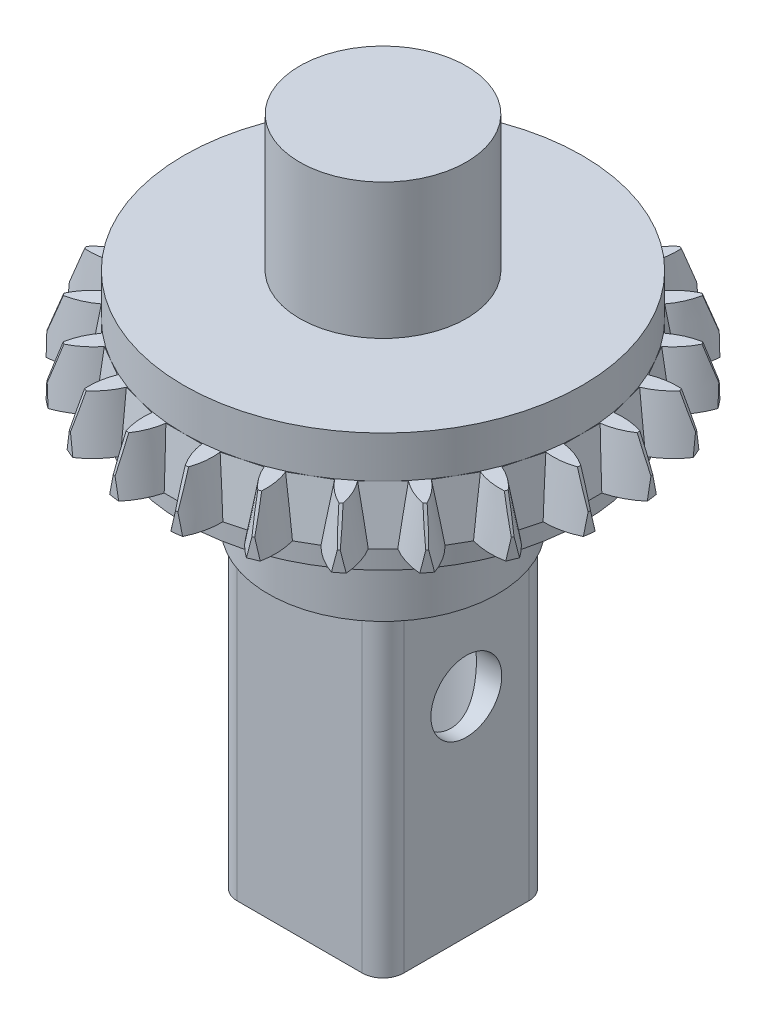
from build123d import *

# Parameters (mm, degrees)
SKETCH1_R                 = 11.5
BOSS_EXTRUDE1_DEPTH       = 2.5
CUT_EXTRUDE2_DEPTH        = 2.5
CUT_EXTRUDE2_DRAFT        = 10
CIRPATTERN1_COPY_1_DEPTH  = 2.5
CIRPATTERN1_COPY_1_DRAFT  = 10
CIRPATTERN1_COPY_2_DEPTH  = 2.5
CIRPATTERN1_COPY_2_DRAFT  = 10
CIRPATTERN1_COPY_3_DEPTH  = 2.5
CIRPATTERN1_COPY_3_DRAFT  = 10
CIRPATTERN1_COPY_4_DEPTH  = 2.5
CIRPATTERN1_COPY_4_DRAFT  = 10
CIRPATTERN1_COPY_5_DEPTH  = 2.5
CIRPATTERN1_COPY_5_DRAFT  = 10
CIRPATTERN1_COPY_6_DEPTH  = 2.5
CIRPATTERN1_COPY_6_DRAFT  = 10
CIRPATTERN1_COPY_7_DEPTH  = 2.5
CIRPATTERN1_COPY_7_DRAFT  = 10
CIRPATTERN1_COPY_8_DEPTH  = 2.5
CIRPATTERN1_COPY_8_DRAFT  = 10
CIRPATTERN1_COPY_9_DEPTH  = 2.5
CIRPATTERN1_COPY_9_DRAFT  = 10
CIRPATTERN1_COPY_10_DEPTH = 2.5
CIRPATTERN1_COPY_10_DRAFT = 10
CIRPATTERN1_COPY_11_DEPTH = 2.5
CIRPATTERN1_COPY_11_DRAFT = 10
CIRPATTERN1_COPY_12_DEPTH = 2.5
CIRPATTERN1_COPY_12_DRAFT = 10
CIRPATTERN1_COPY_13_DEPTH = 2.5
CIRPATTERN1_COPY_13_DRAFT = 10
CIRPATTERN1_COPY_14_DEPTH = 2.5
CIRPATTERN1_COPY_14_DRAFT = 10
CIRPATTERN1_COPY_15_DEPTH = 2.5
CIRPATTERN1_COPY_15_DRAFT = 10
CIRPATTERN1_COPY_16_DEPTH = 2.5
CIRPATTERN1_COPY_16_DRAFT = 10
CIRPATTERN1_COPY_17_DEPTH = 2.5
CIRPATTERN1_COPY_17_DRAFT = 10
CIRPATTERN1_COPY_18_DEPTH = 2.5
CIRPATTERN1_COPY_18_DRAFT = 10
CIRPATTERN1_COPY_19_DEPTH = 2.5
CIRPATTERN1_COPY_19_DRAFT = 10
CIRPATTERN1_COPY_20_DEPTH = 2.5
CIRPATTERN1_COPY_20_DRAFT = 10
CIRPATTERN1_COPY_21_DEPTH = 2.5
CIRPATTERN1_COPY_21_DRAFT = 10
CIRPATTERN1_COPY_22_DEPTH = 2.5
CIRPATTERN1_COPY_22_DRAFT = 10
CIRPATTERN1_COPY_23_DEPTH = 2.5
CIRPATTERN1_COPY_23_DRAFT = 10
SKETCH5_R                 = 4
BOSS_EXTRUDE2_DEPTH       = 8.5
SKETCH7_R                 = 9.559182548
BOSS_EXTRUDE4_DEPTH       = 1.2
BOSS_EXTRUDE5_START       = 2
SKETCH10_R                = 9.559182548
BOSS_EXTRUDE5_DEPTH       = 2
SKETCH11_R                = 5.5
BOSS_EXTRUDE6_DEPTH       = 5
SKETCH6_W                 = 8
SKETCH6_H                 = 8
SKETCH6_R                 = 3.26
BOSS_EXTRUDE3_DEPTH       = 15
SKETCH8_R                 = 1.7
CUT_EXTRUDE3_DEPTH        = 29.605417534
FILLET1_R                 = 1


with BuildPart() as part:
    # Sketch1 → Boss-Extrude1 (new body)
    with BuildSketch(Plane(origin=(0, 0, 0), x_dir=(1, 0, 0), z_dir=(0, 1, 0))):
        with Locations(Location((0, 0, 0), (0, 0, 270))):
            Circle(SKETCH1_R)
    extrude(amount=BOSS_EXTRUDE1_DEPTH)


with BuildPart() as cut_extrude2_tool:
    # Sketch4 → Cut-Extrude2 (with draft: the straight prism first)
    with BuildSketch(Plane.XZ):
        with BuildLine():
            Line((-0.5, 10), (0.5, 10))
            ThreePointArc((0.5, 10), (0.791208568, 10.759821048), (1.25, 11.431863365))
            ThreePointArc((1.25, 11.431863365), (0, 11.5), (-1.25, 11.431863365))
            ThreePointArc((-1.25, 11.431863365), (-0.791208568, 10.759821048), (-0.5, 10))
        make_face()
    extrude(amount=-CUT_EXTRUDE2_DEPTH)
    # Cut-Extrude2: the draft: its side faces are tilted about the plane it starts from
    cut_extrude2_sides = [cut_extrude2_tool.faces().sort_by_distance(p)[0] for p in [
        (-0.791208568, 1.25, 10.759821048),
        (0, 1.25, 10),
        (0.791208568, 1.25, 10.759821048),
        (0, 1.25, 11.5),
    ]]
    draft(cut_extrude2_sides, Plane.XZ, CUT_EXTRUDE2_DRAFT)


with BuildPart() as part_1:
    add(part.part)

    # Cut-Extrude2: cut by cut_extrude2_tool
    add(cut_extrude2_tool.part, mode=Mode.SUBTRACT)


with BuildPart() as cirpattern1_copy_1_tool:
    # CirPattern1 copy 1 sketch → CirPattern1 copy 1 (with draft: the straight prism first)
    with BuildSketch(Plane(origin=(0, 0, 0), x_dir=(0.9659258262890683, 0, -0.25881904510252074), z_dir=(0, -1, 0))):
        with BuildLine():
            Line((-0.5, 10), (0.5, 10))
            ThreePointArc((0.5, 10), (0.791208568, 10.759821048), (1.25, 11.431863365))
            ThreePointArc((1.25, 11.431863365), (0, 11.5), (-1.25, 11.431863365))
            ThreePointArc((-1.25, 11.431863365), (-0.791208568, 10.759821048), (-0.5, 10))
        make_face()
    extrude(amount=-CIRPATTERN1_COPY_1_DEPTH)
    # CirPattern1 copy 1: the draft: its side faces are tilted about the plane it starts from
    cirpattern1_copy_1_sides = [cirpattern1_copy_1_tool.faces().sort_by_distance(p)[0] for p in [
        (2.020597819, 1.25, 10.597968883),
        (2.588190451, 1.25, 9.659258263),
        (3.549095399, 1.25, 10.18840919),
        (2.976419019, 1.25, 11.108147002),
    ]]
    draft(cirpattern1_copy_1_sides, Plane(origin=(0, 0, 0), x_dir=(0.9659258262890683, 0, -0.25881904510252074), z_dir=(0, -1, 0)), CIRPATTERN1_COPY_1_DRAFT)


with BuildPart() as part_2:
    add(part_1.part)

    # CirPattern1 copy 1: cut by cirpattern1_copy_1_tool
    add(cirpattern1_copy_1_tool.part, mode=Mode.SUBTRACT)


with BuildPart() as cirpattern1_copy_2_tool:
    # CirPattern1 copy 2 sketch → CirPattern1 copy 2 (with draft: the straight prism first)
    with BuildSketch(Plane(origin=(0, 0, 0), x_dir=(0.8660254037844387, 0, -0.49999999999999994), z_dir=(0, -1, 0))):
        with BuildLine():
            Line((-0.5, 10), (0.5, 10))
            ThreePointArc((0.5, 10), (0.791208568, 10.759821048), (1.25, 11.431863365))
            ThreePointArc((1.25, 11.431863365), (0, 11.5), (-1.25, 11.431863365))
            ThreePointArc((-1.25, 11.431863365), (-0.791208568, 10.759821048), (-0.5, 10))
        make_face()
    extrude(amount=-CIRPATTERN1_COPY_2_DEPTH)
    # CirPattern1 copy 2: the draft: its side faces are tilted about the plane it starts from
    cirpattern1_copy_2_sides = [cirpattern1_copy_2_tool.faces().sort_by_distance(p)[0] for p in [
        (4.694703804, 1.25, 9.713882652),
        (5, 1.25, 8.660254038),
        (6.065117244, 1.25, 8.922674084),
        (5.75, 1.25, 9.959292144),
    ]]
    draft(cirpattern1_copy_2_sides, Plane(origin=(0, 0, 0), x_dir=(0.8660254037844387, 0, -0.49999999999999994), z_dir=(0, -1, 0)), CIRPATTERN1_COPY_2_DRAFT)


with BuildPart() as part_3:
    add(part_2.part)

    # CirPattern1 copy 2: cut by cirpattern1_copy_2_tool
    add(cirpattern1_copy_2_tool.part, mode=Mode.SUBTRACT)


with BuildPart() as cirpattern1_copy_3_tool:
    # CirPattern1 copy 3 sketch → CirPattern1 copy 3 (with draft: the straight prism first)
    with BuildSketch(Plane(origin=(0, 0, 0), x_dir=(0.7071067811865476, 0, -0.7071067811865475), z_dir=(0, -1, 0))):
        with BuildLine():
            Line((-0.5, 10), (0.5, 10))
            ThreePointArc((0.5, 10), (0.791208568, 10.759821048), (1.25, 11.431863365))
            ThreePointArc((1.25, 11.431863365), (0, 11.5), (-1.25, 11.431863365))
            ThreePointArc((-1.25, 11.431863365), (-0.791208568, 10.759821048), (-0.5, 10))
        make_face()
    extrude(amount=-CIRPATTERN1_COPY_3_DEPTH)
    # CirPattern1 copy 3: the draft: its side faces are tilted about the plane it starts from
    cirpattern1_copy_3_sides = [cirpattern1_copy_3_tool.faces().sort_by_distance(p)[0] for p in [
        (7.048873484, 1.25, 8.167811371),
        (7.071067812, 1.25, 7.071067812),
        (8.167811371, 1.25, 7.048873484),
        (8.131727984, 1.25, 8.131727984),
    ]]
    draft(cirpattern1_copy_3_sides, Plane(origin=(0, 0, 0), x_dir=(0.7071067811865476, 0, -0.7071067811865475), z_dir=(0, -1, 0)), CIRPATTERN1_COPY_3_DRAFT)


with BuildPart() as part_4:
    add(part_3.part)

    # CirPattern1 copy 3: cut by cirpattern1_copy_3_tool
    add(cirpattern1_copy_3_tool.part, mode=Mode.SUBTRACT)


with BuildPart() as cirpattern1_copy_4_tool:
    # CirPattern1 copy 4 sketch → CirPattern1 copy 4 (with draft: the straight prism first)
    with BuildSketch(Plane(origin=(0, 0, 0), x_dir=(0.5000000000000001, 0, -0.8660254037844386), z_dir=(0, -1, 0))):
        with BuildLine():
            Line((-0.5, 10), (0.5, 10))
            ThreePointArc((0.5, 10), (0.791208568, 10.759821048), (1.25, 11.431863365))
            ThreePointArc((1.25, 11.431863365), (0, 11.5), (-1.25, 11.431863365))
            ThreePointArc((-1.25, 11.431863365), (-0.791208568, 10.759821048), (-0.5, 10))
        make_face()
    extrude(amount=-CIRPATTERN1_COPY_4_DEPTH)
    # CirPattern1 copy 4: the draft: its side faces are tilted about the plane it starts from
    cirpattern1_copy_4_sides = [cirpattern1_copy_4_tool.faces().sort_by_distance(p)[0] for p in [
        (8.922674084, 1.25, 6.065117244),
        (8.660254038, 1.25, 5),
        (9.713882652, 1.25, 4.694703804),
        (9.959292144, 1.25, 5.75),
    ]]
    draft(cirpattern1_copy_4_sides, Plane(origin=(0, 0, 0), x_dir=(0.5000000000000001, 0, -0.8660254037844386), z_dir=(0, -1, 0)), CIRPATTERN1_COPY_4_DRAFT)


with BuildPart() as part_5:
    add(part_4.part)

    # CirPattern1 copy 4: cut by cirpattern1_copy_4_tool
    add(cirpattern1_copy_4_tool.part, mode=Mode.SUBTRACT)


with BuildPart() as cirpattern1_copy_5_tool:
    # CirPattern1 copy 5 sketch → CirPattern1 copy 5 (with draft: the straight prism first)
    with BuildSketch(Plane(origin=(0, 0, 0), x_dir=(0.25881904510252074, 0, -0.9659258262890683), z_dir=(0, -1, 0))):
        with BuildLine():
            Line((-0.5, 10), (0.5, 10))
            ThreePointArc((0.5, 10), (0.791208568, 10.759821048), (1.25, 11.431863365))
            ThreePointArc((1.25, 11.431863365), (0, 11.5), (-1.25, 11.431863365))
            ThreePointArc((-1.25, 11.431863365), (-0.791208568, 10.759821048), (-0.5, 10))
        make_face()
    extrude(amount=-CIRPATTERN1_COPY_5_DEPTH)
    # CirPattern1 copy 5: the draft: its side faces are tilted about the plane it starts from
    cirpattern1_copy_5_sides = [cirpattern1_copy_5_tool.faces().sort_by_distance(p)[0] for p in [
        (10.18840919, 1.25, 3.549095399),
        (9.659258263, 1.25, 2.588190451),
        (10.597968883, 1.25, 2.020597819),
        (11.108147002, 1.25, 2.976419019),
    ]]
    draft(cirpattern1_copy_5_sides, Plane(origin=(0, 0, 0), x_dir=(0.25881904510252074, 0, -0.9659258262890683), z_dir=(0, -1, 0)), CIRPATTERN1_COPY_5_DRAFT)


with BuildPart() as part_6:
    add(part_5.part)

    # CirPattern1 copy 5: cut by cirpattern1_copy_5_tool
    add(cirpattern1_copy_5_tool.part, mode=Mode.SUBTRACT)


with BuildPart() as cirpattern1_copy_6_tool:
    # CirPattern1 copy 6 sketch → CirPattern1 copy 6 (with draft: the straight prism first)
    with BuildSketch(Plane(origin=(0, 0, 0), x_dir=(0, 0, -1), z_dir=(0, -1, 0))):
        with BuildLine():
            Line((-0.5, 10), (0.5, 10))
            ThreePointArc((0.5, 10), (0.791208568, 10.759821048), (1.25, 11.431863365))
            ThreePointArc((1.25, 11.431863365), (0, 11.5), (-1.25, 11.431863365))
            ThreePointArc((-1.25, 11.431863365), (-0.791208568, 10.759821048), (-0.5, 10))
        make_face()
    extrude(amount=-CIRPATTERN1_COPY_6_DEPTH)
    # CirPattern1 copy 6: the draft: its side faces are tilted about the plane it starts from
    cirpattern1_copy_6_sides = [cirpattern1_copy_6_tool.faces().sort_by_distance(p)[0] for p in [
        (10.759821048, 1.25, 0.791208568),
        (10, 1.25, 0),
        (10.759821048, 1.25, -0.791208568),
        (11.5, 1.25, 0),
    ]]
    draft(cirpattern1_copy_6_sides, Plane(origin=(0, 0, 0), x_dir=(0, 0, -1), z_dir=(0, -1, 0)), CIRPATTERN1_COPY_6_DRAFT)


with BuildPart() as part_7:
    add(part_6.part)

    # CirPattern1 copy 6: cut by cirpattern1_copy_6_tool
    add(cirpattern1_copy_6_tool.part, mode=Mode.SUBTRACT)


with BuildPart() as cirpattern1_copy_7_tool:
    # CirPattern1 copy 7 sketch → CirPattern1 copy 7 (with draft: the straight prism first)
    with BuildSketch(Plane(origin=(0, 0, 0), x_dir=(-0.25881904510252085, 0, -0.9659258262890683), z_dir=(0, -1, 0))):
        with BuildLine():
            Line((-0.5, 10), (0.5, 10))
            ThreePointArc((0.5, 10), (0.791208568, 10.759821048), (1.25, 11.431863365))
            ThreePointArc((1.25, 11.431863365), (0, 11.5), (-1.25, 11.431863365))
            ThreePointArc((-1.25, 11.431863365), (-0.791208568, 10.759821048), (-0.5, 10))
        make_face()
    extrude(amount=-CIRPATTERN1_COPY_7_DEPTH)
    # CirPattern1 copy 7: the draft: its side faces are tilted about the plane it starts from
    cirpattern1_copy_7_sides = [cirpattern1_copy_7_tool.faces().sort_by_distance(p)[0] for p in [
        (10.597968883, 1.25, -2.020597819),
        (9.659258263, 1.25, -2.588190451),
        (10.18840919, 1.25, -3.549095399),
        (11.108147002, 1.25, -2.976419019),
    ]]
    draft(cirpattern1_copy_7_sides, Plane(origin=(0, 0, 0), x_dir=(-0.25881904510252085, 0, -0.9659258262890683), z_dir=(0, -1, 0)), CIRPATTERN1_COPY_7_DRAFT)


with BuildPart() as part_8:
    add(part_7.part)

    # CirPattern1 copy 7: cut by cirpattern1_copy_7_tool
    add(cirpattern1_copy_7_tool.part, mode=Mode.SUBTRACT)


with BuildPart() as cirpattern1_copy_8_tool:
    # CirPattern1 copy 8 sketch → CirPattern1 copy 8 (with draft: the straight prism first)
    with BuildSketch(Plane(origin=(0, 0, 0), x_dir=(-0.4999999999999998, 0, -0.8660254037844387), z_dir=(0, -1, 0))):
        with BuildLine():
            Line((-0.5, 10), (0.5, 10))
            ThreePointArc((0.5, 10), (0.791208568, 10.759821048), (1.25, 11.431863365))
            ThreePointArc((1.25, 11.431863365), (0, 11.5), (-1.25, 11.431863365))
            ThreePointArc((-1.25, 11.431863365), (-0.791208568, 10.759821048), (-0.5, 10))
        make_face()
    extrude(amount=-CIRPATTERN1_COPY_8_DEPTH)
    # CirPattern1 copy 8: the draft: its side faces are tilted about the plane it starts from
    cirpattern1_copy_8_sides = [cirpattern1_copy_8_tool.faces().sort_by_distance(p)[0] for p in [
        (9.713882652, 1.25, -4.694703804),
        (8.660254038, 1.25, -5),
        (8.922674084, 1.25, -6.065117244),
        (9.959292144, 1.25, -5.75),
    ]]
    draft(cirpattern1_copy_8_sides, Plane(origin=(0, 0, 0), x_dir=(-0.4999999999999998, 0, -0.8660254037844387), z_dir=(0, -1, 0)), CIRPATTERN1_COPY_8_DRAFT)


with BuildPart() as part_9:
    add(part_8.part)

    # CirPattern1 copy 8: cut by cirpattern1_copy_8_tool
    add(cirpattern1_copy_8_tool.part, mode=Mode.SUBTRACT)


with BuildPart() as cirpattern1_copy_9_tool:
    # CirPattern1 copy 9 sketch → CirPattern1 copy 9 (with draft: the straight prism first)
    with BuildSketch(Plane(origin=(0, 0, 0), x_dir=(-0.7071067811865475, 0, -0.7071067811865476), z_dir=(0, -1, 0))):
        with BuildLine():
            Line((-0.5, 10), (0.5, 10))
            ThreePointArc((0.5, 10), (0.791208568, 10.759821048), (1.25, 11.431863365))
            ThreePointArc((1.25, 11.431863365), (0, 11.5), (-1.25, 11.431863365))
            ThreePointArc((-1.25, 11.431863365), (-0.791208568, 10.759821048), (-0.5, 10))
        make_face()
    extrude(amount=-CIRPATTERN1_COPY_9_DEPTH)
    # CirPattern1 copy 9: the draft: its side faces are tilted about the plane it starts from
    cirpattern1_copy_9_sides = [cirpattern1_copy_9_tool.faces().sort_by_distance(p)[0] for p in [
        (8.167811371, 1.25, -7.048873484),
        (7.071067812, 1.25, -7.071067812),
        (7.048873484, 1.25, -8.167811371),
        (8.131727984, 1.25, -8.131727984),
    ]]
    draft(cirpattern1_copy_9_sides, Plane(origin=(0, 0, 0), x_dir=(-0.7071067811865475, 0, -0.7071067811865476), z_dir=(0, -1, 0)), CIRPATTERN1_COPY_9_DRAFT)


with BuildPart() as part_10:
    add(part_9.part)

    # CirPattern1 copy 9: cut by cirpattern1_copy_9_tool
    add(cirpattern1_copy_9_tool.part, mode=Mode.SUBTRACT)


with BuildPart() as cirpattern1_copy_10_tool:
    # CirPattern1 copy 10 sketch → CirPattern1 copy 10 (with draft: the straight prism first)
    with BuildSketch(Plane(origin=(0, 0, 0), x_dir=(-0.8660254037844387, 0, -0.49999999999999994), z_dir=(0, -1, 0))):
        with BuildLine():
            Line((-0.5, 10), (0.5, 10))
            ThreePointArc((0.5, 10), (0.791208568, 10.759821048), (1.25, 11.431863365))
            ThreePointArc((1.25, 11.431863365), (0, 11.5), (-1.25, 11.431863365))
            ThreePointArc((-1.25, 11.431863365), (-0.791208568, 10.759821048), (-0.5, 10))
        make_face()
    extrude(amount=-CIRPATTERN1_COPY_10_DEPTH)
    # CirPattern1 copy 10: the draft: its side faces are tilted about the plane it starts from
    cirpattern1_copy_10_sides = [cirpattern1_copy_10_tool.faces().sort_by_distance(p)[0] for p in [
        (6.065117244, 1.25, -8.922674084),
        (5, 1.25, -8.660254038),
        (4.694703804, 1.25, -9.713882652),
        (5.75, 1.25, -9.959292144),
    ]]
    draft(cirpattern1_copy_10_sides, Plane(origin=(0, 0, 0), x_dir=(-0.8660254037844387, 0, -0.49999999999999994), z_dir=(0, -1, 0)), CIRPATTERN1_COPY_10_DRAFT)


with BuildPart() as part_11:
    add(part_10.part)

    # CirPattern1 copy 10: cut by cirpattern1_copy_10_tool
    add(cirpattern1_copy_10_tool.part, mode=Mode.SUBTRACT)


with BuildPart() as cirpattern1_copy_11_tool:
    # CirPattern1 copy 11 sketch → CirPattern1 copy 11 (with draft: the straight prism first)
    with BuildSketch(Plane(origin=(0, 0, 0), x_dir=(-0.9659258262890682, 0, -0.258819045102521), z_dir=(0, -1, 0))):
        with BuildLine():
            Line((-0.5, 10), (0.5, 10))
            ThreePointArc((0.5, 10), (0.791208568, 10.759821048), (1.25, 11.431863365))
            ThreePointArc((1.25, 11.431863365), (0, 11.5), (-1.25, 11.431863365))
            ThreePointArc((-1.25, 11.431863365), (-0.791208568, 10.759821048), (-0.5, 10))
        make_face()
    extrude(amount=-CIRPATTERN1_COPY_11_DEPTH)
    # CirPattern1 copy 11: the draft: its side faces are tilted about the plane it starts from
    cirpattern1_copy_11_sides = [cirpattern1_copy_11_tool.faces().sort_by_distance(p)[0] for p in [
        (3.549095399, 1.25, -10.18840919),
        (2.588190451, 1.25, -9.659258263),
        (2.020597819, 1.25, -10.597968883),
        (2.976419019, 1.25, -11.108147002),
    ]]
    draft(cirpattern1_copy_11_sides, Plane(origin=(0, 0, 0), x_dir=(-0.9659258262890682, 0, -0.258819045102521), z_dir=(0, -1, 0)), CIRPATTERN1_COPY_11_DRAFT)


with BuildPart() as part_12:
    add(part_11.part)

    # CirPattern1 copy 11: cut by cirpattern1_copy_11_tool
    add(cirpattern1_copy_11_tool.part, mode=Mode.SUBTRACT)


with BuildPart() as cirpattern1_copy_12_tool:
    # CirPattern1 copy 12 sketch → CirPattern1 copy 12 (with draft: the straight prism first)
    with BuildSketch(Plane(origin=(0, 0, 0), x_dir=(-1, 0, 0), z_dir=(0, -1, 0))):
        with BuildLine():
            Line((-0.5, 10), (0.5, 10))
            ThreePointArc((0.5, 10), (0.791208568, 10.759821048), (1.25, 11.431863365))
            ThreePointArc((1.25, 11.431863365), (0, 11.5), (-1.25, 11.431863365))
            ThreePointArc((-1.25, 11.431863365), (-0.791208568, 10.759821048), (-0.5, 10))
        make_face()
    extrude(amount=-CIRPATTERN1_COPY_12_DEPTH)
    # CirPattern1 copy 12: the draft: its side faces are tilted about the plane it starts from
    cirpattern1_copy_12_sides = [cirpattern1_copy_12_tool.faces().sort_by_distance(p)[0] for p in [
        (0.791208568, 1.25, -10.759821048),
        (0, 1.25, -10),
        (-0.791208568, 1.25, -10.759821048),
        (0, 1.25, -11.5),
    ]]
    draft(cirpattern1_copy_12_sides, Plane(origin=(0, 0, 0), x_dir=(-1, 0, 0), z_dir=(0, -1, 0)), CIRPATTERN1_COPY_12_DRAFT)


with BuildPart() as part_13:
    add(part_12.part)

    # CirPattern1 copy 12: cut by cirpattern1_copy_12_tool
    add(cirpattern1_copy_12_tool.part, mode=Mode.SUBTRACT)


with BuildPart() as cirpattern1_copy_13_tool:
    # CirPattern1 copy 13 sketch → CirPattern1 copy 13 (with draft: the straight prism first)
    with BuildSketch(Plane(origin=(0, 0, 0), x_dir=(-0.9659258262890683, 0, 0.2588190451025208), z_dir=(0, -1, 0))):
        with BuildLine():
            Line((-0.5, 10), (0.5, 10))
            ThreePointArc((0.5, 10), (0.791208568, 10.759821048), (1.25, 11.431863365))
            ThreePointArc((1.25, 11.431863365), (0, 11.5), (-1.25, 11.431863365))
            ThreePointArc((-1.25, 11.431863365), (-0.791208568, 10.759821048), (-0.5, 10))
        make_face()
    extrude(amount=-CIRPATTERN1_COPY_13_DEPTH)
    # CirPattern1 copy 13: the draft: its side faces are tilted about the plane it starts from
    cirpattern1_copy_13_sides = [cirpattern1_copy_13_tool.faces().sort_by_distance(p)[0] for p in [
        (-2.020597819, 1.25, -10.597968883),
        (-2.588190451, 1.25, -9.659258263),
        (-3.549095399, 1.25, -10.18840919),
        (-2.976419019, 1.25, -11.108147002),
    ]]
    draft(cirpattern1_copy_13_sides, Plane(origin=(0, 0, 0), x_dir=(-0.9659258262890683, 0, 0.2588190451025208), z_dir=(0, -1, 0)), CIRPATTERN1_COPY_13_DRAFT)


with BuildPart() as part_14:
    add(part_13.part)

    # CirPattern1 copy 13: cut by cirpattern1_copy_13_tool
    add(cirpattern1_copy_13_tool.part, mode=Mode.SUBTRACT)


with BuildPart() as cirpattern1_copy_14_tool:
    # CirPattern1 copy 14 sketch → CirPattern1 copy 14 (with draft: the straight prism first)
    with BuildSketch(Plane(origin=(0, 0, 0), x_dir=(-0.8660254037844386, 0, 0.5000000000000001), z_dir=(0, -1, 0))):
        with BuildLine():
            Line((-0.5, 10), (0.5, 10))
            ThreePointArc((0.5, 10), (0.791208568, 10.759821048), (1.25, 11.431863365))
            ThreePointArc((1.25, 11.431863365), (0, 11.5), (-1.25, 11.431863365))
            ThreePointArc((-1.25, 11.431863365), (-0.791208568, 10.759821048), (-0.5, 10))
        make_face()
    extrude(amount=-CIRPATTERN1_COPY_14_DEPTH)
    # CirPattern1 copy 14: the draft: its side faces are tilted about the plane it starts from
    cirpattern1_copy_14_sides = [cirpattern1_copy_14_tool.faces().sort_by_distance(p)[0] for p in [
        (-4.694703804, 1.25, -9.713882652),
        (-5, 1.25, -8.660254038),
        (-6.065117244, 1.25, -8.922674084),
        (-5.75, 1.25, -9.959292144),
    ]]
    draft(cirpattern1_copy_14_sides, Plane(origin=(0, 0, 0), x_dir=(-0.8660254037844386, 0, 0.5000000000000001), z_dir=(0, -1, 0)), CIRPATTERN1_COPY_14_DRAFT)


with BuildPart() as part_15:
    add(part_14.part)

    # CirPattern1 copy 14: cut by cirpattern1_copy_14_tool
    add(cirpattern1_copy_14_tool.part, mode=Mode.SUBTRACT)


with BuildPart() as cirpattern1_copy_15_tool:
    # CirPattern1 copy 15 sketch → CirPattern1 copy 15 (with draft: the straight prism first)
    with BuildSketch(Plane(origin=(0, 0, 0), x_dir=(-0.7071067811865477, 0, 0.7071067811865475), z_dir=(0, -1, 0))):
        with BuildLine():
            Line((-0.5, 10), (0.5, 10))
            ThreePointArc((0.5, 10), (0.791208568, 10.759821048), (1.25, 11.431863365))
            ThreePointArc((1.25, 11.431863365), (0, 11.5), (-1.25, 11.431863365))
            ThreePointArc((-1.25, 11.431863365), (-0.791208568, 10.759821048), (-0.5, 10))
        make_face()
    extrude(amount=-CIRPATTERN1_COPY_15_DEPTH)
    # CirPattern1 copy 15: the draft: its side faces are tilted about the plane it starts from
    cirpattern1_copy_15_sides = [cirpattern1_copy_15_tool.faces().sort_by_distance(p)[0] for p in [
        (-7.048873484, 1.25, -8.167811371),
        (-7.071067812, 1.25, -7.071067812),
        (-8.167811371, 1.25, -7.048873484),
        (-8.131727984, 1.25, -8.131727984),
    ]]
    draft(cirpattern1_copy_15_sides, Plane(origin=(0, 0, 0), x_dir=(-0.7071067811865477, 0, 0.7071067811865475), z_dir=(0, -1, 0)), CIRPATTERN1_COPY_15_DRAFT)


with BuildPart() as part_16:
    add(part_15.part)

    # CirPattern1 copy 15: cut by cirpattern1_copy_15_tool
    add(cirpattern1_copy_15_tool.part, mode=Mode.SUBTRACT)


with BuildPart() as cirpattern1_copy_16_tool:
    # CirPattern1 copy 16 sketch → CirPattern1 copy 16 (with draft: the straight prism first)
    with BuildSketch(Plane(origin=(0, 0, 0), x_dir=(-0.5000000000000004, 0, 0.8660254037844384), z_dir=(0, -1, 0))):
        with BuildLine():
            Line((-0.5, 10), (0.5, 10))
            ThreePointArc((0.5, 10), (0.791208568, 10.759821048), (1.25, 11.431863365))
            ThreePointArc((1.25, 11.431863365), (0, 11.5), (-1.25, 11.431863365))
            ThreePointArc((-1.25, 11.431863365), (-0.791208568, 10.759821048), (-0.5, 10))
        make_face()
    extrude(amount=-CIRPATTERN1_COPY_16_DEPTH)
    # CirPattern1 copy 16: the draft: its side faces are tilted about the plane it starts from
    cirpattern1_copy_16_sides = [cirpattern1_copy_16_tool.faces().sort_by_distance(p)[0] for p in [
        (-8.922674084, 1.25, -6.065117244),
        (-8.660254038, 1.25, -5),
        (-9.713882652, 1.25, -4.694703804),
        (-9.959292144, 1.25, -5.75),
    ]]
    draft(cirpattern1_copy_16_sides, Plane(origin=(0, 0, 0), x_dir=(-0.5000000000000004, 0, 0.8660254037844384), z_dir=(0, -1, 0)), CIRPATTERN1_COPY_16_DRAFT)


with BuildPart() as part_17:
    add(part_16.part)

    # CirPattern1 copy 16: cut by cirpattern1_copy_16_tool
    add(cirpattern1_copy_16_tool.part, mode=Mode.SUBTRACT)


with BuildPart() as cirpattern1_copy_17_tool:
    # CirPattern1 copy 17 sketch → CirPattern1 copy 17 (with draft: the straight prism first)
    with BuildSketch(Plane(origin=(0, 0, 0), x_dir=(-0.25881904510252063, 0, 0.9659258262890683), z_dir=(0, -1, 0))):
        with BuildLine():
            Line((-0.5, 10), (0.5, 10))
            ThreePointArc((0.5, 10), (0.791208568, 10.759821048), (1.25, 11.431863365))
            ThreePointArc((1.25, 11.431863365), (0, 11.5), (-1.25, 11.431863365))
            ThreePointArc((-1.25, 11.431863365), (-0.791208568, 10.759821048), (-0.5, 10))
        make_face()
    extrude(amount=-CIRPATTERN1_COPY_17_DEPTH)
    # CirPattern1 copy 17: the draft: its side faces are tilted about the plane it starts from
    cirpattern1_copy_17_sides = [cirpattern1_copy_17_tool.faces().sort_by_distance(p)[0] for p in [
        (-10.18840919, 1.25, -3.549095399),
        (-9.659258263, 1.25, -2.588190451),
        (-10.597968883, 1.25, -2.020597819),
        (-11.108147002, 1.25, -2.976419019),
    ]]
    draft(cirpattern1_copy_17_sides, Plane(origin=(0, 0, 0), x_dir=(-0.25881904510252063, 0, 0.9659258262890683), z_dir=(0, -1, 0)), CIRPATTERN1_COPY_17_DRAFT)


with BuildPart() as part_18:
    add(part_17.part)

    # CirPattern1 copy 17: cut by cirpattern1_copy_17_tool
    add(cirpattern1_copy_17_tool.part, mode=Mode.SUBTRACT)


with BuildPart() as cirpattern1_copy_18_tool:
    # CirPattern1 copy 18 sketch → CirPattern1 copy 18 (with draft: the straight prism first)
    with BuildSketch(Plane(origin=(0, 0, 0), x_dir=(0, 0, 1), z_dir=(0, -1, 0))):
        with BuildLine():
            Line((-0.5, 10), (0.5, 10))
            ThreePointArc((0.5, 10), (0.791208568, 10.759821048), (1.25, 11.431863365))
            ThreePointArc((1.25, 11.431863365), (0, 11.5), (-1.25, 11.431863365))
            ThreePointArc((-1.25, 11.431863365), (-0.791208568, 10.759821048), (-0.5, 10))
        make_face()
    extrude(amount=-CIRPATTERN1_COPY_18_DEPTH)
    # CirPattern1 copy 18: the draft: its side faces are tilted about the plane it starts from
    cirpattern1_copy_18_sides = [cirpattern1_copy_18_tool.faces().sort_by_distance(p)[0] for p in [
        (-10.759821048, 1.25, -0.791208568),
        (-10, 1.25, 0),
        (-10.759821048, 1.25, 0.791208568),
        (-11.5, 1.25, 0),
    ]]
    draft(cirpattern1_copy_18_sides, Plane(origin=(0, 0, 0), x_dir=(0, 0, 1), z_dir=(0, -1, 0)), CIRPATTERN1_COPY_18_DRAFT)


with BuildPart() as part_19:
    add(part_18.part)

    # CirPattern1 copy 18: cut by cirpattern1_copy_18_tool
    add(cirpattern1_copy_18_tool.part, mode=Mode.SUBTRACT)


with BuildPart() as cirpattern1_copy_19_tool:
    # CirPattern1 copy 19 sketch → CirPattern1 copy 19 (with draft: the straight prism first)
    with BuildSketch(Plane(origin=(0, 0, 0), x_dir=(0.2588190451025203, 0, 0.9659258262890684), z_dir=(0, -1, 0))):
        with BuildLine():
            Line((-0.5, 10), (0.5, 10))
            ThreePointArc((0.5, 10), (0.791208568, 10.759821048), (1.25, 11.431863365))
            ThreePointArc((1.25, 11.431863365), (0, 11.5), (-1.25, 11.431863365))
            ThreePointArc((-1.25, 11.431863365), (-0.791208568, 10.759821048), (-0.5, 10))
        make_face()
    extrude(amount=-CIRPATTERN1_COPY_19_DEPTH)
    # CirPattern1 copy 19: the draft: its side faces are tilted about the plane it starts from
    cirpattern1_copy_19_sides = [cirpattern1_copy_19_tool.faces().sort_by_distance(p)[0] for p in [
        (-10.597968883, 1.25, 2.020597819),
        (-9.659258263, 1.25, 2.588190451),
        (-10.18840919, 1.25, 3.549095399),
        (-11.108147002, 1.25, 2.976419019),
    ]]
    draft(cirpattern1_copy_19_sides, Plane(origin=(0, 0, 0), x_dir=(0.2588190451025203, 0, 0.9659258262890684), z_dir=(0, -1, 0)), CIRPATTERN1_COPY_19_DRAFT)


with BuildPart() as part_20:
    add(part_19.part)

    # CirPattern1 copy 19: cut by cirpattern1_copy_19_tool
    add(cirpattern1_copy_19_tool.part, mode=Mode.SUBTRACT)


with BuildPart() as cirpattern1_copy_20_tool:
    # CirPattern1 copy 20 sketch → CirPattern1 copy 20 (with draft: the straight prism first)
    with BuildSketch(Plane(origin=(0, 0, 0), x_dir=(0.5000000000000001, 0, 0.8660254037844386), z_dir=(0, -1, 0))):
        with BuildLine():
            Line((-0.5, 10), (0.5, 10))
            ThreePointArc((0.5, 10), (0.791208568, 10.759821048), (1.25, 11.431863365))
            ThreePointArc((1.25, 11.431863365), (0, 11.5), (-1.25, 11.431863365))
            ThreePointArc((-1.25, 11.431863365), (-0.791208568, 10.759821048), (-0.5, 10))
        make_face()
    extrude(amount=-CIRPATTERN1_COPY_20_DEPTH)
    # CirPattern1 copy 20: the draft: its side faces are tilted about the plane it starts from
    cirpattern1_copy_20_sides = [cirpattern1_copy_20_tool.faces().sort_by_distance(p)[0] for p in [
        (-9.713882652, 1.25, 4.694703804),
        (-8.660254038, 1.25, 5),
        (-8.922674084, 1.25, 6.065117244),
        (-9.959292144, 1.25, 5.75),
    ]]
    draft(cirpattern1_copy_20_sides, Plane(origin=(0, 0, 0), x_dir=(0.5000000000000001, 0, 0.8660254037844386), z_dir=(0, -1, 0)), CIRPATTERN1_COPY_20_DRAFT)


with BuildPart() as part_21:
    add(part_20.part)

    # CirPattern1 copy 20: cut by cirpattern1_copy_20_tool
    add(cirpattern1_copy_20_tool.part, mode=Mode.SUBTRACT)


with BuildPart() as cirpattern1_copy_21_tool:
    # CirPattern1 copy 21 sketch → CirPattern1 copy 21 (with draft: the straight prism first)
    with BuildSketch(Plane(origin=(0, 0, 0), x_dir=(0.7071067811865474, 0, 0.7071067811865477), z_dir=(0, -1, 0))):
        with BuildLine():
            Line((-0.5, 10), (0.5, 10))
            ThreePointArc((0.5, 10), (0.791208568, 10.759821048), (1.25, 11.431863365))
            ThreePointArc((1.25, 11.431863365), (0, 11.5), (-1.25, 11.431863365))
            ThreePointArc((-1.25, 11.431863365), (-0.791208568, 10.759821048), (-0.5, 10))
        make_face()
    extrude(amount=-CIRPATTERN1_COPY_21_DEPTH)
    # CirPattern1 copy 21: the draft: its side faces are tilted about the plane it starts from
    cirpattern1_copy_21_sides = [cirpattern1_copy_21_tool.faces().sort_by_distance(p)[0] for p in [
        (-8.167811371, 1.25, 7.048873484),
        (-7.071067812, 1.25, 7.071067812),
        (-7.048873484, 1.25, 8.167811371),
        (-8.131727984, 1.25, 8.131727984),
    ]]
    draft(cirpattern1_copy_21_sides, Plane(origin=(0, 0, 0), x_dir=(0.7071067811865474, 0, 0.7071067811865477), z_dir=(0, -1, 0)), CIRPATTERN1_COPY_21_DRAFT)


with BuildPart() as part_22:
    add(part_21.part)

    # CirPattern1 copy 21: cut by cirpattern1_copy_21_tool
    add(cirpattern1_copy_21_tool.part, mode=Mode.SUBTRACT)


with BuildPart() as cirpattern1_copy_22_tool:
    # CirPattern1 copy 22 sketch → CirPattern1 copy 22 (with draft: the straight prism first)
    with BuildSketch(Plane(origin=(0, 0, 0), x_dir=(0.8660254037844384, 0, 0.5000000000000004), z_dir=(0, -1, 0))):
        with BuildLine():
            Line((-0.5, 10), (0.5, 10))
            ThreePointArc((0.5, 10), (0.791208568, 10.759821048), (1.25, 11.431863365))
            ThreePointArc((1.25, 11.431863365), (0, 11.5), (-1.25, 11.431863365))
            ThreePointArc((-1.25, 11.431863365), (-0.791208568, 10.759821048), (-0.5, 10))
        make_face()
    extrude(amount=-CIRPATTERN1_COPY_22_DEPTH)
    # CirPattern1 copy 22: the draft: its side faces are tilted about the plane it starts from
    cirpattern1_copy_22_sides = [cirpattern1_copy_22_tool.faces().sort_by_distance(p)[0] for p in [
        (-6.065117244, 1.25, 8.922674084),
        (-5, 1.25, 8.660254038),
        (-4.694703804, 1.25, 9.713882652),
        (-5.75, 1.25, 9.959292144),
    ]]
    draft(cirpattern1_copy_22_sides, Plane(origin=(0, 0, 0), x_dir=(0.8660254037844384, 0, 0.5000000000000004), z_dir=(0, -1, 0)), CIRPATTERN1_COPY_22_DRAFT)


with BuildPart() as part_23:
    add(part_22.part)

    # CirPattern1 copy 22: cut by cirpattern1_copy_22_tool
    add(cirpattern1_copy_22_tool.part, mode=Mode.SUBTRACT)


with BuildPart() as cirpattern1_copy_23_tool:
    # CirPattern1 copy 23 sketch → CirPattern1 copy 23 (with draft: the straight prism first)
    with BuildSketch(Plane(origin=(0, 0, 0), x_dir=(0.9659258262890683, 0, 0.2588190451025207), z_dir=(0, -1, 0))):
        with BuildLine():
            Line((-0.5, 10), (0.5, 10))
            ThreePointArc((0.5, 10), (0.791208568, 10.759821048), (1.25, 11.431863365))
            ThreePointArc((1.25, 11.431863365), (0, 11.5), (-1.25, 11.431863365))
            ThreePointArc((-1.25, 11.431863365), (-0.791208568, 10.759821048), (-0.5, 10))
        make_face()
    extrude(amount=-CIRPATTERN1_COPY_23_DEPTH)
    # CirPattern1 copy 23: the draft: its side faces are tilted about the plane it starts from
    cirpattern1_copy_23_sides = [cirpattern1_copy_23_tool.faces().sort_by_distance(p)[0] for p in [
        (-3.549095399, 1.25, 10.18840919),
        (-2.588190451, 1.25, 9.659258263),
        (-2.020597819, 1.25, 10.597968883),
        (-2.976419019, 1.25, 11.108147002),
    ]]
    draft(cirpattern1_copy_23_sides, Plane(origin=(0, 0, 0), x_dir=(0.9659258262890683, 0, 0.2588190451025207), z_dir=(0, -1, 0)), CIRPATTERN1_COPY_23_DRAFT)


with BuildPart() as part_24:
    add(part_23.part)

    # CirPattern1 copy 23: cut by cirpattern1_copy_23_tool
    add(cirpattern1_copy_23_tool.part, mode=Mode.SUBTRACT)

    # Sketch9 → Cut-Revolve1 (revolve, cut)
    with BuildSketch(Plane.XY):
        Polygon((11.75, 0.25), (11.75, 2.5), (10.931066973, 2.5), align=None)
    revolve(axis=Axis((0, 0, 0), (0, 1, 0)), mode=Mode.SUBTRACT)

    # Sketch5 → Boss-Extrude2 (add)
    with BuildSketch(Plane(origin=(0, 2.5, 0), x_dir=(1, 0, 0), z_dir=(0, 1, 0))):
        with Locations(Location((0, 0, 0), (0, 0, 270))):
            Circle(SKETCH5_R)
    extrude(amount=BOSS_EXTRUDE2_DEPTH)

    # Sketch7 → Boss-Extrude4 (add)
    with BuildSketch(Plane.XZ):
        with Locations(Location((0, 0, 0), (0, 0, 90))):
            Circle(SKETCH7_R)
    extrude(amount=BOSS_EXTRUDE4_DEPTH)

    # Sketch10 → Boss-Extrude5 (add)
    with BuildSketch(Plane(origin=(0, 2.5, 0), x_dir=(1, 0, 0), z_dir=(0, 1, 0)).offset(BOSS_EXTRUDE5_START)):
        with Locations(Location((0, 0, 0), (0, 0, 270))):
            Circle(SKETCH10_R)
    extrude(amount=-BOSS_EXTRUDE5_DEPTH)

    # Sketch11 → Boss-Extrude6 (add)
    with BuildSketch(Plane.XZ.offset(1.2)):
        with Locations(Location((0, 0, 0), (0, 0, 270))):
            Circle(SKETCH11_R)
    extrude(amount=BOSS_EXTRUDE6_DEPTH)

    # Sketch6 → Boss-Extrude3 (add)
    with BuildSketch(Plane.XZ.offset(6.2)):
        Rectangle(SKETCH6_W, SKETCH6_H)
        with Locations(Location((0, 0, 0), (0, 0, 270))):
            Circle(SKETCH6_R, mode=Mode.SUBTRACT)
    extrude(amount=BOSS_EXTRUDE3_DEPTH)

    # Sketch8 → Cut-Extrude3 (cut, through all)
    with BuildSketch(Plane.ZY.offset(4)):
        with Locations((0, -11.2)):
            Circle(SKETCH8_R)
    extrude(amount=-CUT_EXTRUDE3_DEPTH, mode=Mode.SUBTRACT)

    # Fillet1
    # the kernel refuses this fillet: 1 mm, written as the material it takes off along each edge
    with BuildSketch(Plane(origin=(4, -6.2, -4), x_dir=(-1, 0, 0), z_dir=(0, -1, 0))) as fillet1_piece_1:
        with BuildLine():
            CenterArc((FILLET1_R, -FILLET1_R), FILLET1_R, 90, 90)
            Line((0, -FILLET1_R), (0, 0))
            Line((0, 0), (FILLET1_R, 0))
        make_face()
    extrude(amount=17.5, mode=Mode.SUBTRACT)
    with BuildSketch(Plane(origin=(4, -6.2, 4), x_dir=(-1, 0, 0), z_dir=(0, -1, 0)), Plane(origin=(-4, -6.2, 4), x_dir=(0, 0, -1), z_dir=(0, -1, 0)), Plane(origin=(-4, -6.2, -4), x_dir=(1, 0, 0), z_dir=(0, -1, 0))) as fillet1_piece_2:
        with BuildLine():
            CenterArc((FILLET1_R, FILLET1_R), FILLET1_R, 180, 90)
            Line((0, FILLET1_R), (0, 0))
            Line((0, 0), (FILLET1_R, 0))
        make_face()
    extrude(amount=17.5, mode=Mode.SUBTRACT)


solid = part_24.part
